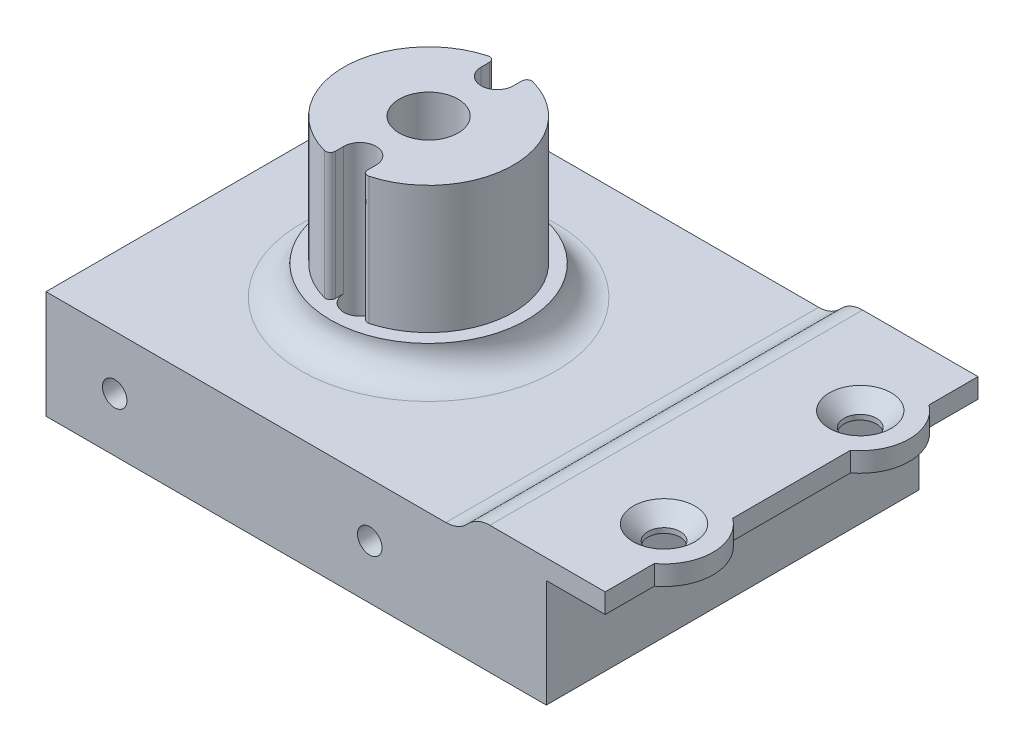
from build123d import *

# Parameters (mm, degrees)
SKETCH_6_W             = 51
SKETCH_6_H             = 38
EXTRUDE_647_DEPTH      = 11
SKETCH_10_R            = 10
EXTRUDE_856_DEPTH      = 3
FILLET_1_R             = 3
SKETCH_13_R            = 1.25
CUT_EXTRUDE_1173_DEPTH = 52
SKETCH_15_R            = 8.65
EXTRUDE_1309_DEPTH     = 13
CUT_EXTRUDE_START      = -13
CUT_EXTRUDE_1600_DEPTH = 13
SKETCH_26_R            = 1.65
CUT_EXTRUDE_1838_DEPTH = 39.961519478
CHAMFER_7_SIZE         = 2
SKETCH_17_R            = 3
CUT_EXTRUDE_2253_DEPTH = 46.287967497
SKETCH_19_W            = 14
SKETCH_19_H            = 38
EXTRUDE_2866_DEPTH     = 2
SKETCH_20_R            = 1.65
CUT_EXTRUDE_3095_DEPTH = 44.886216515
SKETCH_23_R            = 5
SKETCH_23_R_2          = 1.65
EXTRUDE_3300_DEPTH     = 2
CHAMFER_4_SIZE         = 1
FILLET_7_R             = 3
CHAMFER_6_SIZE         = 1.5
FILLET_8_R             = 0.5


with BuildPart() as part:
    # Эскиз6 → Extrude 647 (new body)
    with BuildSketch(Plane(origin=(0, 0, 0), x_dir=(1, 0, 0), z_dir=(0, 1, 0))):
        with Locations((5.5, 0)):
            Rectangle(SKETCH_6_W, SKETCH_6_H)
    extrude(amount=EXTRUDE_647_DEPTH)

    # Эскиз10 → Extrude 856 (add)
    with BuildSketch(Plane(origin=(0, 11, 0), x_dir=(1, 0, 0), z_dir=(0, 1, 0))):
        with Locations(Location((0, 0, 0), (0, 0, 90))):
            Circle(SKETCH_10_R)
    extrude(amount=EXTRUDE_856_DEPTH)

    # Скругление1
    fillet_1_edges = [part.edges().sort_by_distance(p)[0] for p in [
        (0, 11, 10),
    ]]
    fillet(fillet_1_edges, radius=FILLET_1_R - 0.0001)  # a hair under: the kernel refuses the full size

    # Эскиз13 → Cut-Extrude 1173 (cut, through all)
    with BuildSketch(Plane.XY.offset(19)):
        with Locations((-13, 5.5)):
            Circle(SKETCH_13_R)
        with Locations((13, 5.5)):
            Circle(SKETCH_13_R)
    extrude(amount=-CUT_EXTRUDE_1173_DEPTH, mode=Mode.SUBTRACT)

    # Эскиз15 → Extrude 1309 (add)
    with BuildSketch(Plane(origin=(0, 14, 0), x_dir=(1, 0, 0), z_dir=(0, 1, 0))):
        with Locations(Location((0, 0, 0), (0, 0, 90))):
            Circle(SKETCH_15_R)
    extrude(amount=EXTRUDE_1309_DEPTH)

    # Эскиз16 → Cut-Extrude 1600 (cut)
    with BuildSketch(Plane(origin=(0, 27, 0), x_dir=(1, 0, 0), z_dir=(0, 1, 0)).offset(CUT_EXTRUDE_START)):
        with BuildLine():
            Line((-1.65, 7), (-1.65, 8.491171886))
            ThreePointArc((-1.65, 8.491171886), (0, 8.65), (1.65, 8.491171886))
            Line((1.65, 8.491171886), (1.65, 7))
            ThreePointArc((1.65, 7), (0, 5.35), (-1.65, 7))
        make_face()
        with BuildLine():
            Line((1.65, -7), (1.65, -8.491171886))
            ThreePointArc((1.65, -8.491171886), (0, -8.65), (-1.65, -8.491171886))
            Line((-1.65, -8.491171886), (-1.65, -7))
            ThreePointArc((-1.65, -7), (0, -5.35), (1.65, -7))
        make_face()
    extrude(amount=CUT_EXTRUDE_1600_DEPTH, mode=Mode.SUBTRACT)

    # Эскиз26 → Cut-Extrude 1838 (cut, through all)
    with BuildSketch(Plane(origin=(0, 14, 0), x_dir=(1, 0, 0), z_dir=(0, 1, 0))):
        with Locations(Location((0, 7, 0), (0, 0, 270))):
            Circle(SKETCH_26_R)
        with Locations(Location((0, -7, 0), (0, 0, 270))):
            Circle(SKETCH_26_R)
    extrude(amount=-CUT_EXTRUDE_1838_DEPTH, mode=Mode.SUBTRACT)

    # Фаска7
    chamfer_7_edges = [part.edges().sort_by_distance(p)[0] for p in [
        (0, 0, -8.65),
        (0, 0, 5.35),
    ]]
    chamfer(chamfer_7_edges, length=CHAMFER_7_SIZE)

    # Эскиз17 → Cut-Extrude 2253 (cut, through all)
    with BuildSketch(Plane(origin=(0, 27, 0), x_dir=(1, 0, 0), z_dir=(0, 1, 0))):
        with Locations(Location((0, 0, 0), (0, 0, 270))):
            Circle(SKETCH_17_R)
    extrude(amount=-CUT_EXTRUDE_2253_DEPTH, mode=Mode.SUBTRACT)

    # Эскиз19 → Extrude 2866 (add)
    with BuildSketch(Plane(origin=(0, 11, 0), x_dir=(1, 0, 0), z_dir=(0, 1, 0))):
        with Locations((30, 0)):
            Rectangle(SKETCH_19_W, SKETCH_19_H)
    extrude(amount=EXTRUDE_2866_DEPTH)

    # Эскиз20 → Cut-Extrude 3095 (cut, through all)
    with BuildSketch(Plane(origin=(0, 13, 0), x_dir=(1, 0, 0), z_dir=(0, 1, 0))):
        with Locations(Location((34, 10, 0), (0, 0, 270))):
            Circle(SKETCH_20_R)
        with Locations(Location((34, -10, 0), (0, 0, 270))):
            Circle(SKETCH_20_R)
    extrude(amount=-CUT_EXTRUDE_3095_DEPTH, mode=Mode.SUBTRACT)

    # Эскиз23 → Extrude 3300 (add)
    # profile 1 of 2: a face of its own
    with BuildSketch(Plane(origin=(0, 13, 0), x_dir=(1, 0, 0), z_dir=(0, 1, 0))):
        with Locations((34, 10)):
            Circle(SKETCH_23_R)
        with Locations(Location((34, 10, 0), (0, 0, 270))):
            Circle(SKETCH_23_R_2, mode=Mode.SUBTRACT)
    # profile 2 of 2: a face of its own
    with BuildSketch(Plane(origin=(0, 13, 0), x_dir=(1, 0, 0), z_dir=(0, 1, 0))):
        with Locations((34, -10)):
            Circle(SKETCH_23_R)
        with Locations(Location((34, -10, 0), (0, 0, 270))):
            Circle(SKETCH_23_R_2, mode=Mode.SUBTRACT)
    extrude(amount=-EXTRUDE_3300_DEPTH)

    # Фаска4
    chamfer_4_edges = [part.edges().sort_by_distance(p)[0] for p in [
        (23, 11, 0),
    ]]
    chamfer(chamfer_4_edges, length=CHAMFER_4_SIZE)
    chamfer_4_2_edges = [part.edges().sort_by_distance(p)[0] for p in [
        (23, 13, 0),
    ]]
    chamfer(chamfer_4_2_edges, length=CHAMFER_4_SIZE - 0.0001)  # a hair under: the kernel refuses the full size

    # Скругление7
    fillet_7_edges = [part.edges().sort_by_distance(p)[0] for p in [
        (23.9999, 13, 0),
        (22, 11, 0),
    ]]
    fillet(fillet_7_edges, radius=FILLET_7_R)

    # Фаска6
    chamfer_6_edges = [part.edges().sort_by_distance(p)[0] for p in [
        (34, 13, -11.65),
        (34, 13, 8.35),
    ]]
    chamfer(chamfer_6_edges, length=CHAMFER_6_SIZE)

    # Скругление8
    fillet_8_edges = [part.edges().sort_by_distance(p)[0] for p in [
        (-1.65, 20.5, -8.491171886),
        (1.65, 20.5, -8.491171886),
        (1.65, 20.5, 8.491171886),
        (-1.65, 20.5, 8.491171886),
    ]]
    fillet(fillet_8_edges, radius=FILLET_8_R)


solid = part.part
